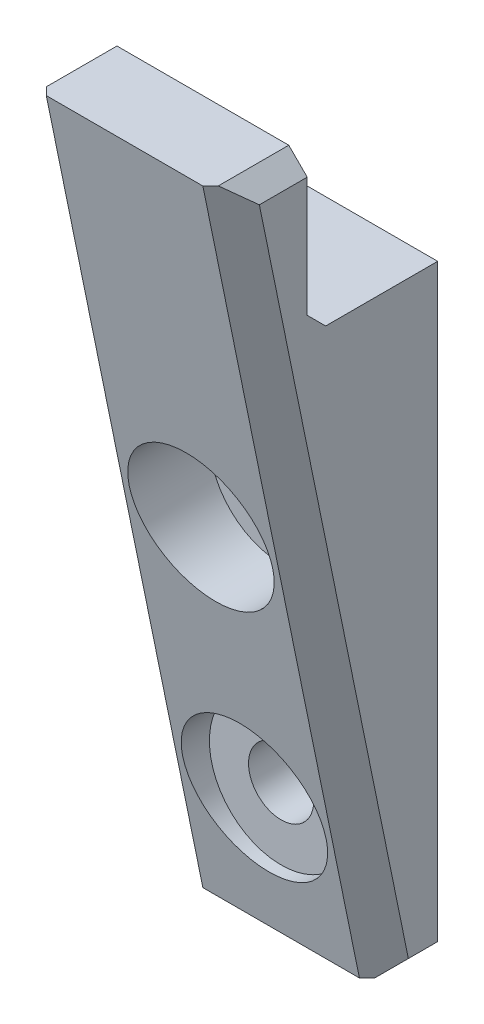
from build123d import *

# Parameters (mm, degrees)
CROQUIS1_W            = 16
CROQUIS1_H            = 90
BASE_DEPTH            = 16
CROQUIS2_R            = 2.5
CROQUIS2_W            = 16
CROQUIS2_H            = 31.42
BARRENOS_DEPTH        = 49.425200051
CORTAR_EXTRUIR1_DEPTH = 49.425200051
CORTAR_EXTRUIR2_DEPTH = 51.368641038
CORTAR_EXTRUIR4_DEPTH = 51.368641038
CHAFL_N2_SIZE         = 2
CROQUIS8_R            = 5.5
CORTAR_EXTRUIR6_DEPTH = 12


with BuildPart() as part:
    # Croquis1 → Base (new body)
    with BuildSketch(Plane.XY):
        Rectangle(CROQUIS1_W, CROQUIS1_H)
    extrude(amount=BASE_DEPTH)

    # Croquis2 → Barrenos (cut, through all)
    with BuildSketch(Plane.XY.offset(16)):
        with Locations((0, -35)):
            Circle(CROQUIS2_R)
        with Locations((0, -15)):
            Circle(CROQUIS2_R)
        with Locations((0, 29.29)):
            Rectangle(CROQUIS2_W, CROQUIS2_H)
    extrude(amount=-BARRENOS_DEPTH, mode=Mode.SUBTRACT)

    # Croquis3 → Cortar-Extruir1 (cut, through all)
    with BuildSketch(Plane.XY.offset(16)):
        Polygon((-6.585786438, 13.58), (-8, 12.165786438), (-8, 13.58), align=None)
        Polygon((6.585786438, 13.58), (8, 12.165786438), (8, 13.58), align=None)
        Polygon((-8, -45), (-8, -43.585786438), (-6.585786438, -45), align=None)
        Polygon((8, -45), (6.585786438, -45), (8, -43.585786438), align=None)
    extrude(amount=-CORTAR_EXTRUIR1_DEPTH, mode=Mode.SUBTRACT)

    # Croquis4 → Cortar-Extruir2 (cut, through all)
    with BuildSketch(Plane.ZY.offset(8)):
        Polygon((8.585786438, 1.58), (10, 2.994213562), (10, 13.58), (0, 13.58), (0, 1.58), align=None)
    extrude(amount=-CORTAR_EXTRUIR2_DEPTH, mode=Mode.SUBTRACT)

    # Croquis6 → Cortar-Extruir4 (cut, through all)
    with BuildSketch(Plane.ZY.offset(8)):
        Polygon((4, -45), (16, -45), (16, 13.58), align=None)
    extrude(amount=-CORTAR_EXTRUIR4_DEPTH, mode=Mode.SUBTRACT)

    # Chaflán2
    chafl_n2_edges = [part.edges().sort_by_distance(p)[0] for p in [
        (-8, -15.71, 10),
        (8, -15.71, 10),
    ]]
    chamfer(chafl_n2_edges, length=CHAFL_N2_SIZE)

    # Croquis8 → Cortar-Extruir6 (cut)
    with BuildSketch(Plane.XY.offset(16)):
        with Locations((0, -15)):
            Circle(CROQUIS8_R)
        with Locations((0, -35)):
            Circle(CROQUIS8_R)
    extrude(amount=-CORTAR_EXTRUIR6_DEPTH, mode=Mode.SUBTRACT)


solid = part.part
